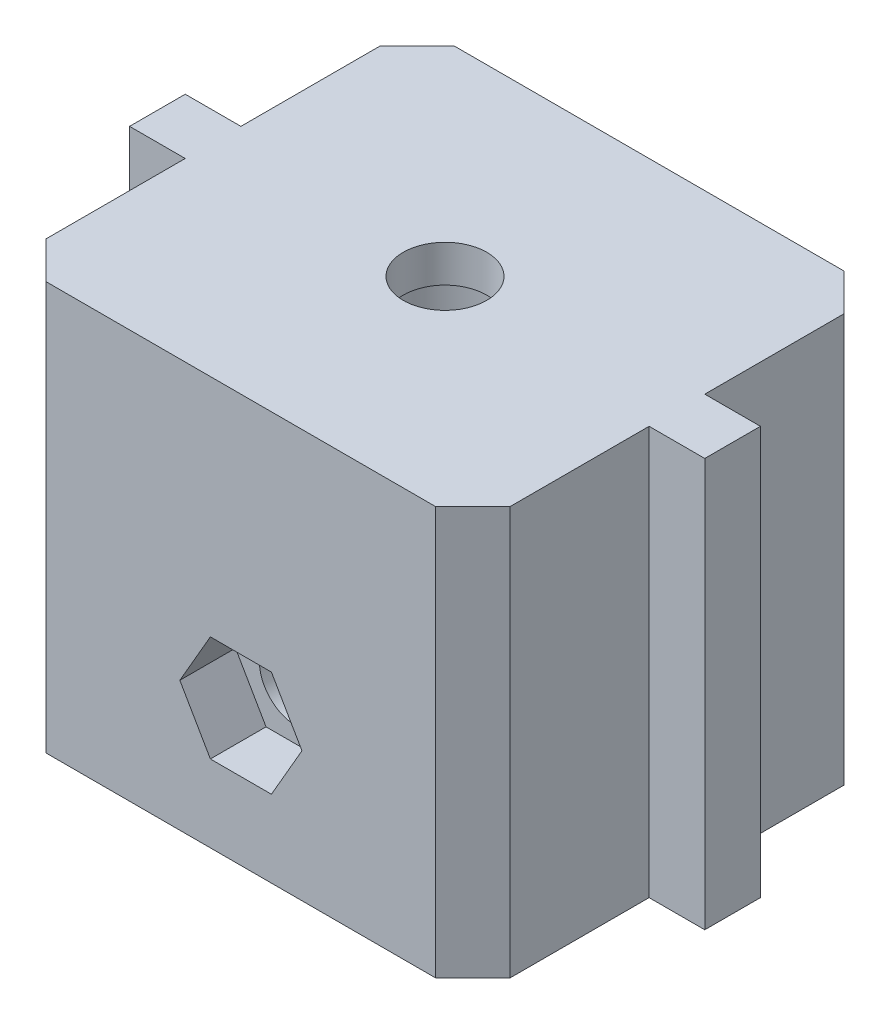
from build123d import *

# Parameters (mm, degrees)
SKETCH1_W           = 25
SKETCH1_H           = 22
BOSS_EXTRUDE1_DEPTH = 22
SKETCH3_W           = 31
SKETCH3_H           = 3
BOSS_EXTRUDE2_DEPTH = 22
SKETCH4_W           = 19
SKETCH4_H           = 16
CUT_EXTRUDE3_DEPTH  = 17
SKETCH5_R           = 3
BOSS_EXTRUDE3_DEPTH = 2.8
BOSS_EXTRUDE4_START = 2.8
SKETCH6_R           = 3
BOSS_EXTRUDE4_DEPTH = 2.8
SKETCH7_R           = 2
CUT_EXTRUDE4_DEPTH  = 35.759890679
CHAMFER1_SIZE       = 3.8
SKETCH8_R           = 3
CUT_EXTRUDE5_DEPTH  = 3
CUT_EXTRUDE6_DEPTH  = 3
CHAMFER2_SIZE       = 2
SKETCH10_R          = 3.75
CUT_EXTRUDE7_DEPTH  = 3
SKETCH11_R          = 2.25
CUT_EXTRUDE8_DEPTH  = 28.590759323


with BuildPart() as part:
    # Sketch1 → Boss-Extrude1 (new body)
    with BuildSketch(Plane(origin=(0, 0, 0), x_dir=(1, 0, 0), z_dir=(0, 1, 0))):
        Rectangle(SKETCH1_W, SKETCH1_H)
    extrude(amount=BOSS_EXTRUDE1_DEPTH)

    # Sketch3 → Boss-Extrude2 (add)
    with BuildSketch(Plane(origin=(0, 0, 0), x_dir=(1, 0, 0), z_dir=(0, 1, 0))):
        Rectangle(SKETCH3_W, SKETCH3_H)
    extrude(amount=BOSS_EXTRUDE2_DEPTH)

    # Sketch4 → Cut-Extrude3 (cut)
    with BuildSketch(Plane(origin=(0, 0, 0), x_dir=(1, 0, 0), z_dir=(0, 1, 0))):
        Rectangle(SKETCH4_W, SKETCH4_H)
    extrude(amount=CUT_EXTRUDE3_DEPTH, mode=Mode.SUBTRACT)

    # Sketch5 → Boss-Extrude3 (add)
    with BuildSketch(Plane(origin=(0, 0, -8), x_dir=(-1, 0, 0), z_dir=(0, 0, -1))):
        with Locations((0, 7)):
            Circle(SKETCH5_R)
    extrude(amount=-BOSS_EXTRUDE3_DEPTH)

    # Sketch6 → Boss-Extrude4 (add)
    with BuildSketch(Plane(origin=(0, 0, 8), x_dir=(-1, 0, 0), z_dir=(0, 0, -1)).offset(BOSS_EXTRUDE4_START)):
        with Locations((0, 7)):
            Circle(SKETCH6_R)
    extrude(amount=-BOSS_EXTRUDE4_DEPTH)

    # Sketch7 → Cut-Extrude4 (cut, through all)
    with BuildSketch(Plane(origin=(0, 0, -11), x_dir=(-1, 0, 0), z_dir=(0, 0, -1))):
        with Locations((0, 7)):
            Circle(SKETCH7_R)
    extrude(amount=-CUT_EXTRUDE4_DEPTH, mode=Mode.SUBTRACT)

    # Chamfer1
    # the kernel refuses this chamfer: 3.8 mm, written as the material it adds along each edge
    with BuildSketch(Plane(origin=(0, 7, 8), x_dir=(-1, 0, 0), z_dir=(0, -1, 0))) as chamfer1_piece_1_section:
        Polygon((3 + CHAMFER1_SIZE, 0), (3, CHAMFER1_SIZE), (3, 0), align=None)
    chamfer1_piece_1 = revolve(axis=Axis((0, 7, 8), (0, 0, -1)), mode=Mode.PRIVATE)
    chamfer1_piece_1 = split(chamfer1_piece_1, bisect_by=Plane(origin=(5.412454592, 7, 5.2), z_dir=(0, 0, 1)), keep=Keep.TOP, mode=Mode.PRIVATE)
    add(chamfer1_piece_1)
    with BuildSketch(Plane(origin=(0, 7, -8), x_dir=(-1, 0, 0), z_dir=(0, -1, 0))) as chamfer1_piece_2_section:
        Polygon((3 + CHAMFER1_SIZE, 0), (3, -CHAMFER1_SIZE), (3, 0), align=None)
    chamfer1_piece_2 = revolve(axis=Axis((0, 7, -8), (0, 0, -1)), mode=Mode.PRIVATE)
    chamfer1_piece_2 = split(chamfer1_piece_2, bisect_by=Plane(origin=(5.412454592, 7, -5.2), z_dir=(0, 0, -1)), keep=Keep.TOP, mode=Mode.PRIVATE)
    add(chamfer1_piece_2)

    # Sketch8 → Cut-Extrude5 (cut)
    with BuildSketch(Plane(origin=(0, 0, -11), x_dir=(-1, 0, 0), z_dir=(0, 0, -1))):
        with Locations((0, 7)):
            Circle(SKETCH8_R)
    extrude(amount=-CUT_EXTRUDE5_DEPTH, mode=Mode.SUBTRACT)

    # Sketch9 → Cut-Extrude6 (cut)
    with BuildSketch(Plane.XY.offset(11)):
        Polygon((1.645448267, 9.85), (-1.645448267, 9.85), (-3.290896534, 7), (-1.645448267, 4.15), (1.645448267, 4.15), (3.290896534, 7), align=None)
    extrude(amount=-CUT_EXTRUDE6_DEPTH, mode=Mode.SUBTRACT)

    # Chamfer2
    chamfer2_edges = [part.edges().sort_by_distance(p)[0] for p in [
        (-9.5, 8.5, 8),
        (-9.5, 8.5, -8),
        (9.5, 8.5, -8),
        (9.5, 8.5, 8),
        (12.5, 11, 11),
        (-12.5, 11, 11),
        (-12.5, 11, -11),
        (12.5, 11, -11),
    ]]
    chamfer(chamfer2_edges, length=CHAMFER2_SIZE)

    # Sketch10 → Cut-Extrude7 (cut)
    with BuildSketch(Plane.XZ.offset(-17)):
        with Locations(Location((0, 0, 0), (0, 0, 270))):
            Circle(SKETCH10_R)
    extrude(amount=-CUT_EXTRUDE7_DEPTH, mode=Mode.SUBTRACT)

    # Sketch11 → Cut-Extrude8 (cut, through all)
    with BuildSketch(Plane.XZ.offset(-20)):
        with Locations(Location((0, 0, 0), (0, 0, 270))):
            Circle(SKETCH11_R)
    extrude(amount=-CUT_EXTRUDE8_DEPTH, mode=Mode.SUBTRACT)


solid = part.part
